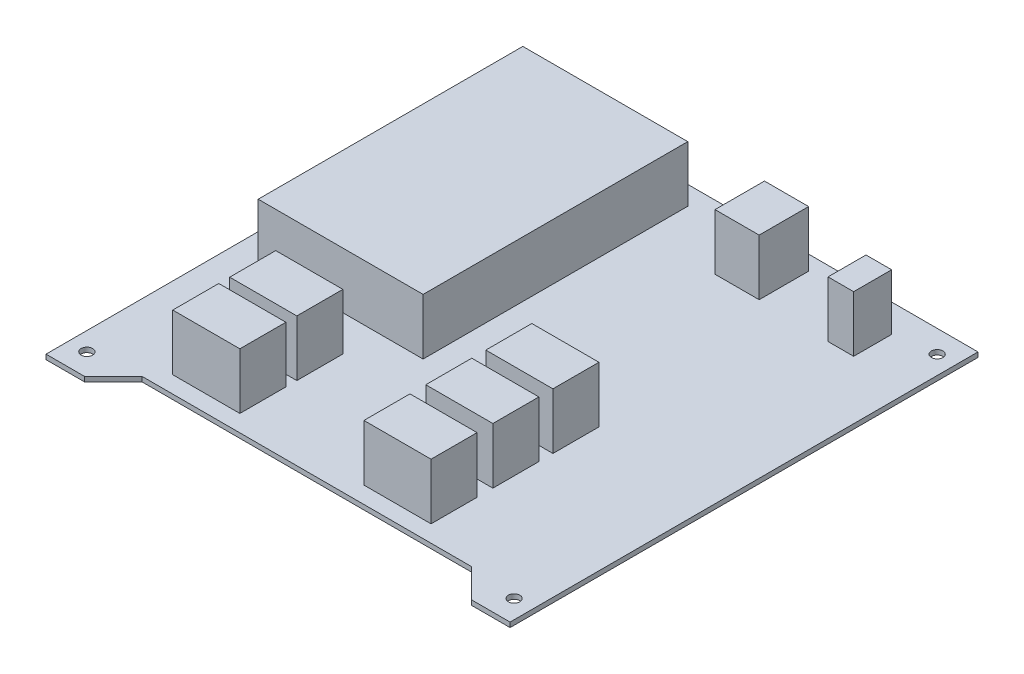
from build123d import *

# Parameters (mm, degrees)
SKETCH1_R           = 1.905
BOSS_EXTRUDE1_DEPTH = 1.5875
SKETCH2_W           = 22.225
SKETCH2_H           = 15.24
SKETCH2_W_2         = 14.620181031
SKETCH2_H_2         = 16.374602754
SKETCH2_W_3         = 54.61
SKETCH2_H_3         = 87.63
SKETCH2_W_4         = 8.479704998
SKETCH2_H_4         = 12.573355687
BOSS_EXTRUDE2_DEPTH = 18.542


with BuildPart() as part:
    # Sketch1 → Boss-Extrude1 (new body)
    with BuildSketch(Plane(origin=(0, 0, 0), x_dir=(1, 0, 0), z_dir=(0, 1, 0))):
        Polygon((-76.835, 77.47), (76.835, 77.47), (76.835, -77.47), (64.135, -77.47), (54.61, -67.945), (-54.61, -67.945), (-64.135, -77.47), (-76.835, -77.47), align=None)
        with Locations((-70.739, 70.0405)):
            Circle(SKETCH1_R, mode=Mode.SUBTRACT)
        with Locations((-70.739, -70.0405)):
            Circle(SKETCH1_R, mode=Mode.SUBTRACT)
        with Locations((70.739, -70.0405)):
            Circle(SKETCH1_R, mode=Mode.SUBTRACT)
        with Locations((70.739, 70.0405)):
            Circle(SKETCH1_R, mode=Mode.SUBTRACT)
    extrude(amount=BOSS_EXTRUDE1_DEPTH)

    # Sketch2 → Boss-Extrude2 (add)
    with BuildSketch(Plane(origin=(0, 1.5875, 0), x_dir=(1, 0, 0), z_dir=(0, 1, 0))):
        with Locations((-38.837784726, -54.764880682)):
            Rectangle(SKETCH2_W, SKETCH2_H)
        with Locations((-38.837784726, -35.904847152)):
            Rectangle(SKETCH2_W, SKETCH2_H)
        with Locations((24.469923971, -54.764880682)):
            Rectangle(SKETCH2_W, SKETCH2_H)
        with Locations((24.469923971, -34.296627238)):
            Rectangle(SKETCH2_W, SKETCH2_H)
        with Locations((24.469923971, -14.413181036)):
            Rectangle(SKETCH2_W, SKETCH2_H)
        with Locations((18.328285521, 64.38959472)):
            Rectangle(SKETCH2_W_2, SKETCH2_H_2)
        with Locations((-40.291302772, 27.368792631)):
            Rectangle(SKETCH2_W_3, SKETCH2_H_3)
        with Locations((53.270518185, 61.904163944)):
            Rectangle(SKETCH2_W_4, SKETCH2_H_4)
    extrude(amount=BOSS_EXTRUDE2_DEPTH)


solid = part.part
